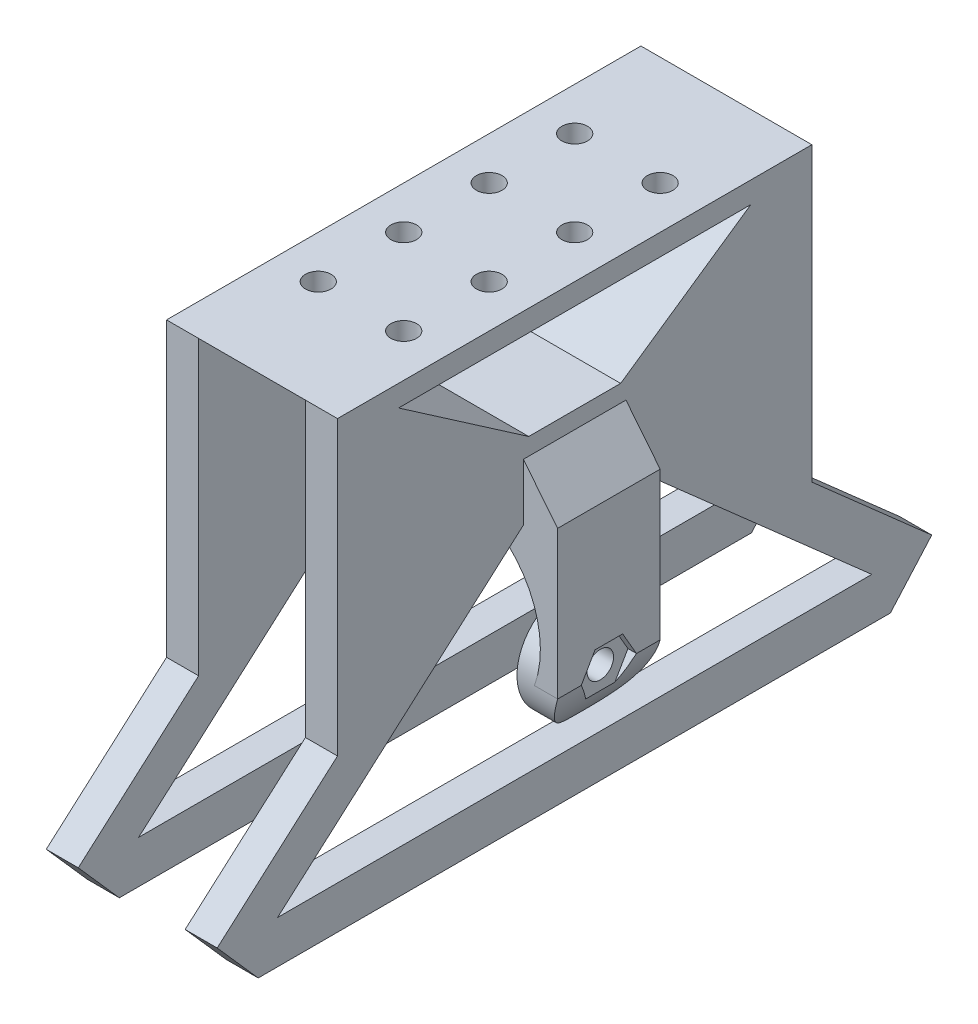
from build123d import *

# Parameters (mm, degrees)
EXTRUDE_1_DEPTH      = 12
EXTRUDE_2_REACH      = 35.545
EXTRUDE_2_END_RADIUS = 11.985372339
SKETCH_2_R           = 6
MIRROR_START         = 9.249795062
MIRROR_1_DEPTH       = 2.735782315
MIRROR_1_2_DEPTH     = 0.000409876
CUT_EXTRUDE_1_DEPTH  = 34.545141776
CUT_EXTRUDE_2_DEPTH  = 1
CUT_EXTRUDE_3_DEPTH  = 1
MIRROR_START_2       = 9.250204938
MIRROR_3_DEPTH       = 5.749795062
SKETCH_6_R           = 1.55
CUT_EXTRUDE_4_DEPTH  = 37.245193425
SKETCH_12_W          = 20
SKETCH_12_H          = 12
EXTRUDE_4_DEPTH      = 5
EXTRUDE_5_DEPTH      = 10
EXTRUDE_6_DEPTH      = 12
EXTRUDE_7_DEPTH      = 3.75
EXTRUDE_8_DEPTH      = 3.75
SKETCH_21_R          = 1.5
CUT_EXTRUDE_5_DEPTH  = 3


with BuildPart() as part:
    # 스케치1 → 보스-돌출1 (new body)
    with BuildSketch(Plane.XY):
        with BuildLine():
            Line((14.000204938, 2.291069809), (-13.999795062, 2.291069809))
            Line((-13.999795062, 2.291069809), (-13.999795062, -6.939240191))
            Line((-13.999795062, -6.939240191), (-13.999795062, -15.005030191))
            ThreePointArc((-13.999795062, -15.005030191), (-12.699794, -18.209549332), (-10.647895062, -20.993190191))
            Line((-10.647895062, -20.993190191), (-9.249795062, -20.993190191))
            Line((-9.249795062, -20.993190191), (-9.249795062, -18.61185417))
            ThreePointArc((-9.249795062, -18.61185417), (-10.428409882, -16.897436148), (-11.292795062, -15.005030191))
            ThreePointArc((-11.292795062, -15.005030191), (0.000204938, 0.99497801), (11.293204938, -15.005030191))
            ThreePointArc((11.293204938, -15.005030191), (10.428819757, -16.897436148), (9.250204938, -18.61185417))
            Line((9.250204938, -18.61185417), (9.250204938, -20.993190191))
            Line((9.250204938, -20.993190191), (10.648304938, -20.993190191))
            ThreePointArc((10.648304938, -20.993190191), (12.700203875, -18.209549332), (14.000204938, -15.005030191))
            Line((14.000204938, -15.005030191), (14.000204938, -6.939240191))
            Line((14.000204938, -6.939240191), (14.000204938, 2.291069809))
        make_face()
    extrude(amount=EXTRUDE_1_DEPTH)

    # 보스-돌출2: up to this cylinder (the profile starts inside it)
    extrude_2_end = Plane(origin=(0.000204938, -10.990394329, 6), z_dir=(0, 0, -1)) * Cylinder(EXTRUDE_2_END_RADIUS, 96.060744678, mode=Mode.PRIVATE)
    # 스케치2 → 보스-돌출2 (add, up to the surface)
    with BuildSketch(Plane(origin=(-9.249795062, 0, 0), x_dir=(0, 0, -1), z_dir=(1, 0, 0)), mode=Mode.PRIVATE) as extrude_2_sk1:
        with Locations((-6, -14.993190191)):
            Circle(SKETCH_2_R)
    extrude_2_tool1 = extrude(extrude_2_sk1.sketch, amount=-EXTRUDE_2_REACH, mode=Mode.PRIVATE) & extrude_2_end
    add(extrude_2_tool1.solids().sort_by_distance((-9.249795, -14.99319, 6))[0])

    # 대칭 복사1: read off the stored shape, not the designer's step
    # 대칭 복사1 outline → 대칭 복사1 (add)
    with BuildSketch(Plane.YZ.offset(MIRROR_START)):
        with BuildLine():
            ThreePointArc((-18.61185417, 1.214054847), (-8.993190191, 6), (-18.61185417, 10.785945153))
            Line((-18.61185417, 10.785945153), (-18.61185417, 1.214054847))
        make_face()
    extrude(amount=MIRROR_1_DEPTH)

    # Mirror 1 2 outline → Mirror 1 2 (add)
    with BuildSketch(Plane.YZ.offset(MIRROR_START)):
        with BuildLine():
            Line((-18.61185417, 1.214054847), (-18.61185417, 10.785945153))
            ThreePointArc((-18.61185417, 10.785945153), (-20.993190191, 6), (-18.61185417, 1.214054847))
        make_face()
    extrude(amount=MIRROR_1_2_DEPTH)

    # 스케치3 → 컷-돌출1 (cut, through all)
    with BuildSketch(Plane(origin=(-9.249795062, 0, 0), x_dir=(0, 0, -1), z_dir=(1, 0, 0))):
        with BuildLine():
            Line((-6, -20.993190191), (0, -20.993190191))
            Line((0, -20.993190191), (0, -18.61185417))
            Line((0, -18.61185417), (-1.214054847, -18.61185417))
            ThreePointArc((-1.214054847, -18.61185417), (-3.327172272, -20.364967545), (-6, -20.993190191))
        make_face()
        with BuildLine():
            Line((-12, -20.993190191), (-6, -20.993190191))
            ThreePointArc((-6, -20.993190191), (-8.672827728, -20.364967545), (-10.785945153, -18.61185417))
            Line((-10.785945153, -18.61185417), (-12, -18.61185417))
            Line((-12, -18.61185417), (-12, -20.993190191))
        make_face()
        with BuildLine():
            Line((-12, -18.61185417), (-10.785945153, -18.61185417))
            ThreePointArc((-10.785945153, -18.61185417), (-11.688394805, -16.901635773), (-12, -14.993190191))
            Line((-12, -14.993190191), (-12, -18.61185417))
        make_face()
        with BuildLine():
            Line((-1.214054847, -18.61185417), (0, -18.61185417))
            Line((0, -18.61185417), (0, -14.993190191))
            ThreePointArc((0, -14.993190191), (-0.311605195, -16.901635773), (-1.214054847, -18.61185417))
        make_face()
    extrude(amount=-CUT_EXTRUDE_1_DEPTH, mode=Mode.SUBTRACT)

    # 스케치4 → 컷-돌출2 (cut)
    with BuildSketch(Plane.ZY.offset(13.999795062)):
        Polygon((9.23, -15.005030191), (7.615, -12.207768137), (4.385, -12.207768137), (2.77, -15.005030191), (4.385, -17.802292245), (7.615, -17.802292245), align=None)
    extrude(amount=-CUT_EXTRUDE_2_DEPTH, mode=Mode.SUBTRACT)

    # 스케치5 → 컷-돌출3 (cut)
    with BuildSketch(Plane(origin=(14.000204938, 0, 0), x_dir=(0, 0, -1), z_dir=(1, 0, 0))):
        Polygon((-2.77, -15.005030191), (-4.385, -12.207768137), (-7.615, -12.207768137), (-9.23, -15.005030191), (-7.615, -17.802292245), (-4.385, -17.802292245), align=None)
    extrude(amount=-CUT_EXTRUDE_3_DEPTH, mode=Mode.SUBTRACT)

    # 대칭 복사3: read off the stored shape, not the designer's step
    # 대칭 복사3 outline → 대칭 복사3 (cut)
    with BuildSketch(Plane.YZ.offset(MIRROR_START_2)):
        with BuildLine():
            ThreePointArc((-20.993190191, 6), (-19.235830878, 10.242640687), (-14.993190191, 12))
            Line((-14.993190191, 12), (-20.993190191, 12))
            Line((-20.993190191, 12), (-20.993190191, 6))
        make_face()
        with BuildLine():
            Line((-20.993190191, 0), (-14.993190191, 0))
            ThreePointArc((-14.993190191, 0), (-19.235830878, 1.757359313), (-20.993190191, 6))
            Line((-20.993190191, 6), (-20.993190191, 0))
        make_face()
    extrude(amount=MIRROR_3_DEPTH, mode=Mode.SUBTRACT)

    # 스케치6 → 컷-돌출4 (cut, through all)
    with BuildSketch(Plane.ZY.offset(12.999795062)):
        with Locations((6, -15.005030191)):
            Circle(SKETCH_6_R)
    extrude(amount=-CUT_EXTRUDE_4_DEPTH, mode=Mode.SUBTRACT)

    # 스케치12 → 보스-돌출4 (add)
    with BuildSketch(Plane(origin=(0, 2.291069809, 0), x_dir=(1, 0, 0), z_dir=(0, 1, 0))):
        with Locations((0, -6)):
            Rectangle(SKETCH_12_W, SKETCH_12_H)
    extrude(amount=EXTRUDE_4_DEPTH)

    # 스케치14 → 보스-돌출5 (add, symmetric)
    with BuildSketch(Plane(origin=(0, 0, 0), x_dir=(0, 0, -1), z_dir=(1, 0, 0))):
        Polygon((-12, 7.291069809), (0, 7.291069809), (21.75, 22.291069809), (-33.75, 22.291069809), align=None)
        Polygon((-11.377217009, 9.291069809), (-0.622782991, 9.291069809), (14.602217009, 19.791069809), (-26.602217009, 19.791069809), align=None, mode=Mode.SUBTRACT)
    extrude(amount=EXTRUDE_5_DEPTH, both=True)

    # 스케치15 → 보스-돌출6 (add)
    with BuildSketch(Plane.XY.offset(12)):
        Polygon((-10, 7.291069809), (-13.999795062, 2.291069809), (-10, 2.291069809), align=None)
        Polygon((10, 2.291069809), (14.000204938, 2.291069809), (10, 7.291069809), align=None)
    extrude(amount=-EXTRUDE_6_DEPTH)

    # 스케치19 → 보스-돌출7 (add)
    with BuildSketch(Plane(origin=(6.25, 0, 0), x_dir=(0, 0, -1), z_dir=(1, 0, 0))):
        Polygon((-12, 7.291069809), (-47.823129142, -24.313497594), (-43.022395989, -29.755030191), (30.938064105, -29.755030191), (35.775707613, -24.271660464), (0, 7.291069809), (0, 0.623337928), (28.765859914, -24.755030191), (-40.765859914, -24.755030191), (-12, 0.623337928), align=None)
    extrude_7 = extrude(amount=EXTRUDE_7_DEPTH)

    # 대칭 복사4: 보스-돌출7 across plane
    add(extrude_7.mirror(Plane(origin=(0, 0, 0), x_dir=(0, 0, 1), z_dir=(1, 0, 0))))

    # 스케치20 → 보스-돌출8 (add)
    with BuildSketch(Plane(origin=(10, 0, 0), x_dir=(0, 0, -1), z_dir=(1, 0, 0))):
        Polygon((-12, 7.291069809), (-33.75, 22.291069809), (-33.75, -11.897631945), align=None)
        Polygon((21.75, 22.291069809), (21.75, -11.897631945), (0, 7.291069809), align=None)
    extrude_8 = extrude(amount=-EXTRUDE_8_DEPTH)

    # 대칭 복사5: 보스-돌출8 across plane
    add(extrude_8.mirror(Plane(origin=(0, 0, 0), x_dir=(0, 0, 1), z_dir=(1, 0, 0))))

    # 스케치21 → 컷-돌출5 (cut)
    with BuildSketch(Plane(origin=(0, 22.291069809, 0), x_dir=(1, 0, 0), z_dir=(0, 1, 0))):
        with Locations(Location((5, 9, 0), (0, 0, 270))):
            Circle(SKETCH_21_R)
        with Locations(Location((5, -1, 0), (0, 0, 270))):
            Circle(SKETCH_21_R)
        with Locations(Location((-5, 9, 0), (0, 0, 90))):
            Circle(SKETCH_21_R)
        with Locations(Location((-5, -1, 0), (0, 0, 90))):
            Circle(SKETCH_21_R)
        with Locations(Location((5, -11, 0), (0, 0, 90))):
            Circle(SKETCH_21_R)
        with Locations(Location((5, -21, 0), (0, 0, 90))):
            Circle(SKETCH_21_R)
        with Locations(Location((-5, -21, 0), (0, 0, 270))):
            Circle(SKETCH_21_R)
        with Locations(Location((-5, -11, 0), (0, 0, 270))):
            Circle(SKETCH_21_R)
    extrude(amount=-CUT_EXTRUDE_5_DEPTH, mode=Mode.SUBTRACT)


solid = part.part
